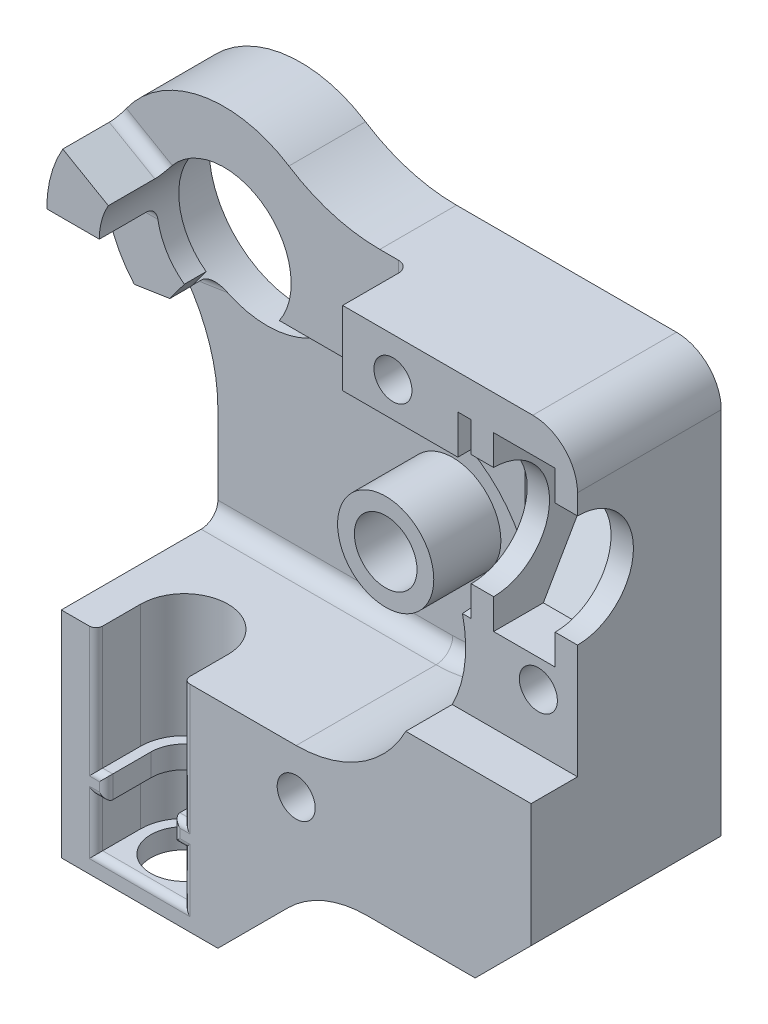
from build123d import *

# Parameters (mm, degrees)
ESBO_O1_R                = 2.8
ESBO_O1_R_2              = 1.7
ESBO_O1_R_3              = 6
RESSALTO_EXTRUS_O1_DEPTH = 17
CORTE_EXTRUS_O1_DEPTH    = 3.5
ESBO_O3_R                = 8.2
CORTE_EXTRUS_O2_DEPTH    = 4.9
CORTE_EXTRUS_O3_DEPTH    = 64.577983611
CORTE_EXTRUS_O4_START    = -14
ESBO_O7_R                = 2.8
CORTE_EXTRUS_O4_DEPTH    = 14
CORTE_EXTRUS_O5_START    = -5
CORTE_EXTRUS_O5_DEPTH    = 5
ESBO_O9_R                = 4.3
ESBO_O9_R_2              = 2.8
RESSALTO_EXTRUS_O2_DEPTH = 6
ESBO_O6_R                = 3
CORTE_EXTRUS_O6_DEPTH    = 19.2
CORTE_EXTRUS_O7_DEPTH    = 4.4
CORTE_EXTRUS_O8_DEPTH    = 11
CORTE_EXTRUS_O9_DEPTH    = 2
FILETE2_R                = 0.6
CORTE_EXTRUS_O10_START   = -5.15
CORTE_EXTRUS_O10_DEPTH   = 5.15
ESBO_O18_R               = 1.7
RESSALTO_EXTRUS_O3_DEPTH = 0.85
FILETE3_R                = 1
ESBO_O14_R               = 5
CORTE_EXTRUS_O11_DEPTH   = 10.7
CORTE_EXTRUS_O13_DEPTH   = 5.5
CORTE_EXTRUS_O14_START   = -6.85
CORTE_EXTRUS_O14_DEPTH   = 6.85
RESSALTO_EXTRUS_O4_DEPTH = 0.85
CHANFRO3_SIZE            = 3
FILETE4_R                = 1
FILETE5_R                = 1.5
CORTE_EXTRUS_O15_REACH   = 63.511
ESBO_O20_R               = 7.7
CORTE_EXTRUS_O16_START   = -6
CORTE_EXTRUS_O16_DEPTH   = 6


with BuildPart() as part:
    # Esboço1 → Ressalto-extrusão1 (new body)
    with BuildSketch(Plane.XY):
        with BuildLine():
            Line((-4.4, -16.856156145), (-4.4, -44.6))
            Line((-4.4, -44.6), (9.6, -44.6))
            Line((9.6, -44.6), (15.871067812, -38.328932188))
            ThreePointArc((15.871067812, -38.328932188), (19.1153013, -36.161204675), (22.942135624, -35.4))
            Line((22.942135624, -35.4), (32.6, -35.4))
            Line((32.6, -35.4), (37.6, -30.4))
            Line((37.6, -30.4), (37.6, 2.6))
            ThreePointArc((37.6, 2.6), (36.428427125, 5.428427125), (33.6, 6.6))
            Line((33.6, 6.6), (13.925875197, 6.6))
            ThreePointArc((13.925875197, 6.6), (9.689429656, 7.210680031), (5.797932475, 8.992996109))
            ThreePointArc((5.797932475, 8.992996109), (-8.086163888, 7.007421322), (-8.077042802, -7.017932714))
            ThreePointArc((-8.077042802, -7.017932714), (-5.349299698, -11.604697204), (-4.4, -16.856156145))
        make_face()
        with Locations((16.6, -14.4)):
            Circle(ESBO_O1_R, mode=Mode.SUBTRACT)
        with Locations((34.1, -14.4)):
            Circle(ESBO_O1_R_2, mode=Mode.SUBTRACT)
        with Locations((16.6, -29.4)):
            Circle(ESBO_O1_R_2, mode=Mode.SUBTRACT)
        with Locations((21.1, 3.1)):
            Circle(ESBO_O1_R_2, mode=Mode.SUBTRACT)
        Circle(ESBO_O1_R_3, mode=Mode.SUBTRACT)
    extrude(amount=RESSALTO_EXTRUS_O1_DEPTH)

    # Esboço2 → Corte-extrusão1 (cut)
    with BuildSketch(Plane(origin=(0, 0, 0), x_dir=(-1, 0, 0), z_dir=(0, 0, -1))):
        Polygon((-19.425684219, 0.2), (-17.751368439, 3.1), (-19.425684219, 6), (-22.774315781, 6), (-24.448631561, 3.1), (-22.774315781, 0.2), align=None)
    extrude(amount=-CORTE_EXTRUS_O1_DEPTH, mode=Mode.SUBTRACT)

    # Esboço3 → Corte-extrusão2 (cut)
    with BuildSketch(Plane(origin=(0, 0, 0), x_dir=(-1, 0, 0), z_dir=(0, 0, -1))):
        Circle(ESBO_O3_R)
    extrude(amount=-CORTE_EXTRUS_O2_DEPTH, mode=Mode.SUBTRACT)

    # Esboço5 → Corte-extrusão3 (cut, through all)
    with BuildSketch(Plane.ZY.offset(4.4)):
        Polygon((0, -44.6), (7, -44.6), (0, -37.6), align=None)
    extrude(amount=-CORTE_EXTRUS_O3_DEPTH, mode=Mode.SUBTRACT)

    # Esboço7 → Corte-extrusão4 (cut)
    # profile 1 of 2: a face of its own
    with BuildSketch(Plane.XY.offset(17).offset(CORTE_EXTRUS_O4_START)):
        with BuildLine():
            ThreePointArc((-5.033307562, -6.849512026), (2.207972734, -8.208218833), (7.790378681, -3.4))
            Line((7.790378681, -3.4), (4.943682838, -3.4))
            ThreePointArc((4.943682838, -3.4), (0.999161337, -5.916221482), (-3.552922985, -4.834949665))
            Line((-3.552922985, -4.834949665), (-5.033307562, -6.849512026))
        make_face()
    # profile 2 of 2: a face of its own
    with BuildSketch(Plane.XY.offset(17).offset(CORTE_EXTRUS_O4_START)):
        with BuildLine():
            ThreePointArc((16.6, -25.4), (27.6, -14.4), (16.6, -3.4))
            Line((16.6, -3.4), (7.790378681, -3.4))
            ThreePointArc((7.790378681, -3.4), (2.207972734, -8.208218833), (-5.033307562, -6.849512026))
            Line((-5.033307562, -6.849512026), (-6.618088542, -9.006140892))
            ThreePointArc((-6.618088542, -9.006140892), (-4.965169349, -12.777472036), (-4.4, -16.856156145))
            Line((-4.4, -16.856156145), (-4.4, -25.4))
            Line((-4.4, -25.4), (16.6, -25.4))
        make_face()
        with Locations((16.6, -14.4)):
            Circle(ESBO_O7_R, mode=Mode.SUBTRACT)
    extrude(amount=CORTE_EXTRUS_O4_DEPTH, mode=Mode.SUBTRACT)

    # Esboço8 → Corte-extrusão5 (cut)
    with BuildSketch(Plane.XY.offset(17).offset(CORTE_EXTRUS_O5_START)):
        with BuildLine():
            Line((26.397958971, -19.4), (37.6, -19.4))
            Line((37.6, -19.4), (37.6, 2.6))
            ThreePointArc((37.6, 2.6), (36.428427125, 5.428427125), (33.6, 6.6))
            Line((33.6, 6.6), (13.925875197, 6.6))
            ThreePointArc((13.925875197, 6.6), (9.689429656, 7.210680031), (5.797932475, 8.992996109))
            ThreePointArc((5.797932475, 8.992996109), (-8.086163888, 7.007421322), (-8.077042802, -7.017932714))
            ThreePointArc((-8.077042802, -7.017932714), (-7.306637516, -7.982003576), (-6.618088542, -9.006140892))
            Line((-6.618088542, -9.006140892), (-3.552922985, -4.834949665))
            ThreePointArc((-3.552922985, -4.834949665), (-0.999161337, 5.916221482), (4.943682838, -3.4))
            Line((4.943682838, -3.4), (16.6, -3.4))
            ThreePointArc((16.6, -3.4), (25.98083152, -8.655437353), (26.397958971, -19.4))
        make_face()
    extrude(amount=CORTE_EXTRUS_O5_DEPTH, mode=Mode.SUBTRACT)

    # Esboço9 → Ressalto-extrusão2 (add)
    with BuildSketch(Plane.XY.offset(3)):
        with Locations((16.6, -14.4)):
            Circle(ESBO_O9_R)
        with Locations((16.6, -14.4)):
            Circle(ESBO_O9_R_2, mode=Mode.SUBTRACT)
    extrude(amount=RESSALTO_EXTRUS_O2_DEPTH)

    # Esboço6 → Corte-extrusão6 (cut)
    with BuildSketch(Plane.XZ.offset(44.6)):
        with Locations(Location((2.6, 13, 0), (0, 0, 270))):
            Circle(ESBO_O6_R)
    extrude(amount=-CORTE_EXTRUS_O6_DEPTH, mode=Mode.SUBTRACT)

    # Esboço10 → Corte-extrusão7 (cut)
    with BuildSketch(Plane(origin=(0, -42.8, 0), x_dir=(-1, 0, 0), z_dir=(0, -1, 0))):
        with BuildLine():
            Line((-6.5, -13), (-6.5, -21))
            Line((-6.5, -21), (1.3, -21))
            Line((1.3, -21), (1.3, -13))
            ThreePointArc((1.3, -13), (-2.6, -9.1), (-6.5, -13))
        make_face()
    extrude(amount=-CORTE_EXTRUS_O7_DEPTH, mode=Mode.SUBTRACT)

    # Esboço11 → Corte-extrusão8 (cut)
    with BuildSketch(Plane(origin=(0, -36.4, 0), x_dir=(-1, 0, 0), z_dir=(0, -1, 0))):
        with BuildLine():
            Line((-6.5, -13), (-6.5, -19.715315286))
            Line((-6.5, -19.715315286), (1.3, -19.715315286))
            Line((1.3, -19.715315286), (1.3, -13))
            ThreePointArc((1.3, -13), (-2.6, -9.1), (-6.5, -13))
        make_face()
    extrude(amount=-CORTE_EXTRUS_O8_DEPTH, mode=Mode.SUBTRACT)

    # Esboço12 → Corte-extrusão9 (cut)
    with BuildSketch(Plane.XZ.offset(38.4)):
        with BuildLine():
            Line((-0.4, 13), (-0.4, 18.969375471))
            Line((-0.4, 18.969375471), (5.6, 18.969375471))
            Line((5.6, 18.969375471), (5.6, 13))
            ThreePointArc((5.6, 13), (2.6, 10), (-0.4, 13))
        make_face()
    extrude(amount=-CORTE_EXTRUS_O9_DEPTH, mode=Mode.SUBTRACT)

    # Filete2
    filete2_edges = [part.edges().sort_by_distance(p)[0] for p in [
        (6.5, -40.6, 17),
        (-1.3, -40.6, 17),
        (-0.85, -38.4, 17),
        (2.6, -42.8, 17),
        (-0.85, -36.4, 17),
        (6.5, -30.9, 17),
        (-1.3, -30.9, 17),
        (6.05, -36.4, 17),
        (6.05, -38.4, 17),
        (-0.4, -37.4, 17),
        (5.6, -37.4, 17),
    ]]
    fillet(filete2_edges, radius=FILETE2_R)

    # Esboço13 → Corte-extrusão10 (cut)
    with BuildSketch(Plane.XY.offset(12).offset(CORTE_EXTRUS_O10_START)):
        with BuildLine():
            Line((16.6, -3.4), (16.6, 6.6))
            Line((16.6, 6.6), (13.925875197, 6.6))
            ThreePointArc((13.925875197, 6.6), (9.689429656, 7.210680031), (5.797932475, 8.992996109))
            ThreePointArc((5.797932475, 8.992996109), (-2.515063908, 10.40021411), (-9.26647182, 5.35))
            Line((-9.26647182, 5.35), (-5.196152423, 3))
            ThreePointArc((-5.196152423, 3), (3.202488911, 5.073860934), (4.943682838, -3.4))
            Line((4.943682838, -3.4), (16.6, -3.4))
        make_face()
        with BuildLine():
            ThreePointArc((-3.552922985, -4.834949665), (-5.353388549, -2.709470621), (-6, 0))
            Line((-6, 0), (-10.7, 0))
            ThreePointArc((-10.7, 0), (-10.022832882, -3.746040711), (-8.077042802, -7.017932714))
            ThreePointArc((-8.077042802, -7.017932714), (-7.306637516, -7.982003576), (-6.618088542, -9.006140892))
            Line((-6.618088542, -9.006140892), (-3.552922985, -4.834949665))
        make_face()
    extrude(amount=CORTE_EXTRUS_O10_DEPTH, mode=Mode.SUBTRACT)

    # Esboço18 → Ressalto-extrusão3 (add)
    with BuildSketch(Plane.XY.offset(12)):
        with BuildLine():
            Line((33.6, 6.6), (16.6, 6.6))
            Line((16.6, 6.6), (16.6, -3.4))
            ThreePointArc((16.6, -3.4), (25.98083152, -8.655437353), (26.397958971, -19.4))
            Line((26.397958971, -19.4), (37.6, -19.4))
            Line((37.6, -19.4), (37.6, 2.6))
            ThreePointArc((37.6, 2.6), (36.428427125, 5.428427125), (33.6, 6.6))
        make_face()
        with Locations(Location((21.1, 3.1, 0), (0, 0, 180))):
            Circle(ESBO_O18_R, mode=Mode.SUBTRACT)
        with Locations((34.1, -14.4)):
            Circle(ESBO_O18_R, mode=Mode.SUBTRACT)
    extrude(amount=RESSALTO_EXTRUS_O3_DEPTH)

    # Filete3
    filete3_edges = [part.edges().sort_by_distance(p)[0] for p in [
        (-8.35, 0, 6.85),
        (-7.231312122, 4.175, 6.85),
    ]]
    fillet(filete3_edges, radius=FILETE3_R)

    # Esboço14 → Corte-extrusão11 (cut)
    with BuildSketch(Plane(origin=(37.6, 0, 0), x_dir=(0, 0, -1), z_dir=(1, 0, 0))):
        with Locations((-12.85, -4.2)):
            Circle(ESBO_O14_R)
    extrude(amount=-CORTE_EXTRUS_O11_DEPTH, mode=Mode.SUBTRACT)

    # Esboço16 → Corte-extrusão13 (cut)
    with BuildSketch(Plane(origin=(35.6, 0, 0), x_dir=(0, 0, -1), z_dir=(1, 0, 0))):
        Polygon((-3.958805854, -4.2), (-8.404402927, 3.5), (-17.295597073, 3.5), (-21.741194146, -4.2), (-17.295597073, -11.9), (-8.404402927, -11.9), align=None)
    extrude(amount=-CORTE_EXTRUS_O13_DEPTH, mode=Mode.SUBTRACT)

    # Esboço17 → Corte-extrusão14 (cut)
    with BuildSketch(Plane.XY.offset(12.85).offset(CORTE_EXTRUS_O14_START)):
        with BuildLine():
            Line((16.6, 0), (26.9, 0))
            Line((26.9, 0), (26.9, -9.2))
            Line((26.9, -9.2), (26.293296653, -9.2))
            ThreePointArc((26.293296653, -9.2), (22.248008499, -4.960720366), (16.6, -3.4))
            Line((16.6, -3.4), (16.6, 0))
        make_face()
    extrude(amount=CORTE_EXTRUS_O14_DEPTH, mode=Mode.SUBTRACT)

    # Esboço19 → Ressalto-extrusão4 (add)
    with BuildSketch(Plane.XY.offset(6)):
        with BuildLine():
            Line((26.9, 0), (16.6, 0))
            Line((16.6, 0), (16.6, -3.4))
            ThreePointArc((16.6, -3.4), (22.248008499, -4.960720366), (26.293296653, -9.2))
            Line((26.293296653, -9.2), (26.9, -9.2))
            Line((26.9, -9.2), (26.9, 0))
        make_face()
    extrude(amount=RESSALTO_EXTRUS_O4_DEPTH)

    # Chanfro3
    # the kernel refuses this chamfer: 3, 2.302242201 mm, written as the material it takes off along each edge
    with BuildSketch(Plane(origin=(-6.618088542, -9.006140892, 3), x_dir=(0.5921538308022283, 0.8058249441822001, 0), z_dir=(0, 0, 1))) as chanfro3_piece_1:
        with BuildLine():
            Line((CHANFRO3_SIZE, 0), (0.721282145, 2.278717855))
            ThreePointArc((0.721282145, 2.278717855), (0.414475085, 1.151512434), (0, 0))
            Line((0, 0), (CHANFRO3_SIZE, 0))
        make_face()
    extrude(amount=11.565048964, mode=Mode.SUBTRACT)

    # Filete4
    filete4_edges = [part.edges().sort_by_distance(p)[0] for p in [
        (16.6, 3.3, 6.85),
        (-6.450969198, -6.834642561, 3),
    ]]
    fillet(filete4_edges, radius=FILETE4_R)

    # Filete5
    filete5_edges = [part.edges().sort_by_distance(p)[0] for p in [
        (6.1, -25.4, 3),
        (12.030951621, -3.4, 3),
        (27.6, -14.4, 3),
    ]]
    fillet(filete5_edges, radius=FILETE5_R)

    # Corte-extrusão15: up to this face of the body (flat: up to its plane)
    corte_extrus_o15_end = Plane(part.part.faces().sort_by_distance((26.9, 0.32230104, 11.820844332))[0])
    # Esboço20 → Corte-extrusão15 (cut, up to the picked face)
    with BuildSketch(Plane(origin=(28.1, 0, 0), x_dir=(0, 0, -1), z_dir=(1, 0, 0)), mode=Mode.PRIVATE) as corte_extrus_o15_sk1:
        with Locations((-12.85, -4.2)):
            Circle(ESBO_O20_R)
    corte_extrus_o15_tool1 = split(extrude(corte_extrus_o15_sk1.sketch, amount=-CORTE_EXTRUS_O15_REACH, mode=Mode.PRIVATE), bisect_by=corte_extrus_o15_end, keep=Keep.BOTH, mode=Mode.PRIVATE)
    add(corte_extrus_o15_tool1.solids().sort_by(Axis((28.1, -4.2, 12.85), (-1, 0, 0)))[0], mode=Mode.SUBTRACT)

    # Esboço21 → Corte-extrusão16 (cut)
    with BuildSketch(Plane.XY.offset(12.85).offset(CORTE_EXTRUS_O16_START)):
        with BuildLine():
            Line((26.9, -10.538653085), (26.9, -9.2))
            Line((26.9, -9.2), (26.293296653, -9.2))
            ThreePointArc((26.293296653, -9.2), (26.619030681, -9.859182429), (26.9, -10.538653085))
        make_face()
    extrude(amount=CORTE_EXTRUS_O16_DEPTH, mode=Mode.SUBTRACT)


solid = part.part
